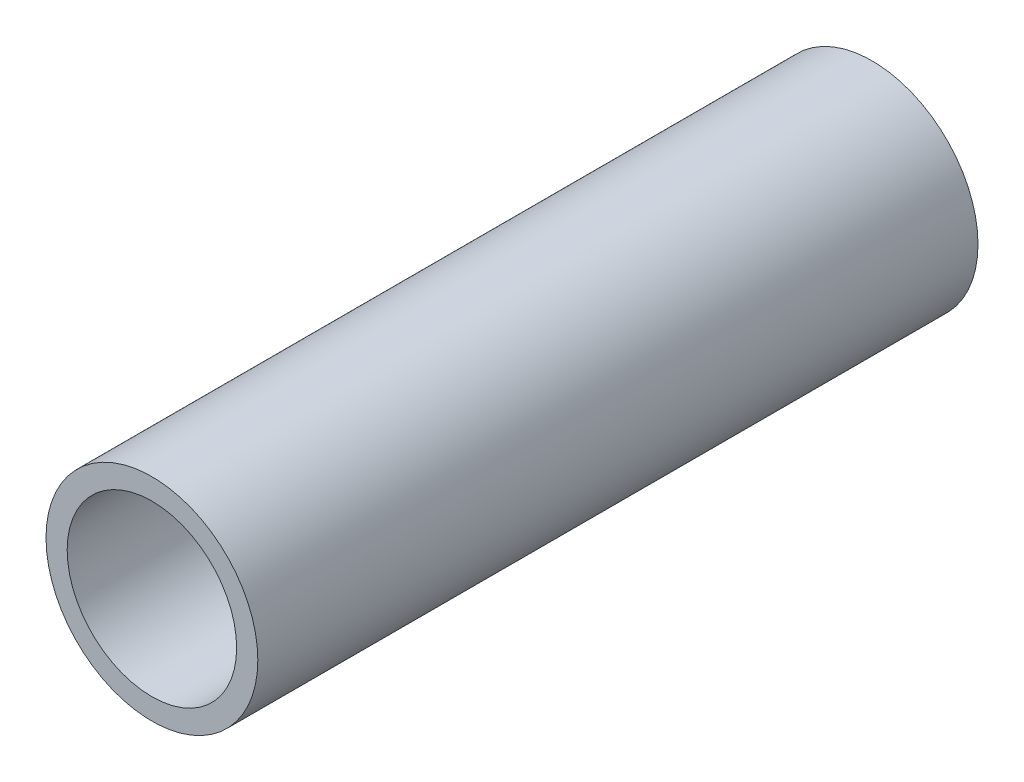
from build123d import *

# Parameters (mm, degrees)
SKETCH1_R           = 7.9375
SKETCH1_R_2         = 6.35
BOSS_EXTRUDE1_DEPTH = 26.9875


with BuildPart() as part:
    # Sketch1 → Boss-Extrude1 (new, symmetric)
    with BuildSketch(Plane.XY):
        Circle(SKETCH1_R)
        Circle(SKETCH1_R_2, mode=Mode.SUBTRACT)
    extrude(amount=BOSS_EXTRUDE1_DEPTH, both=True)


solid = part.part
